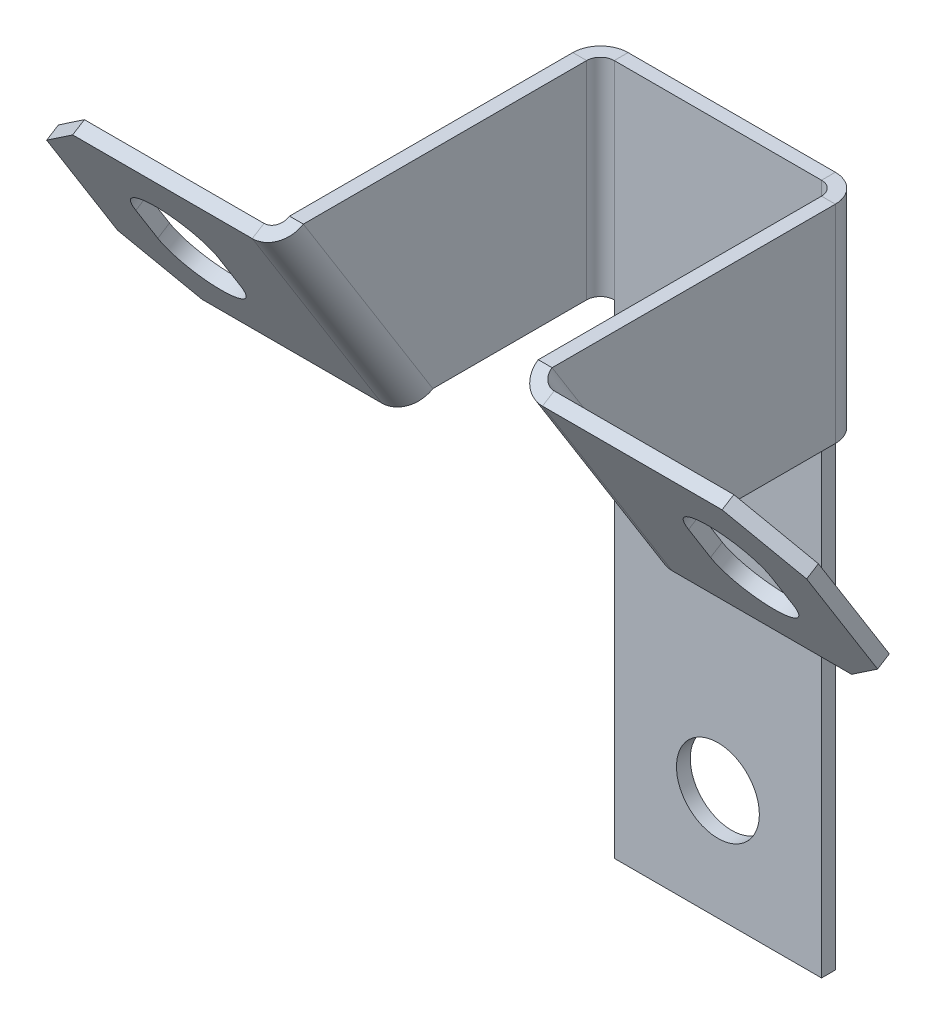
from build123d import *

# Parameters (mm, degrees)
BASE_FLANGE1_START      = -1
BASE_FLANGE1_OUTLINE_W  = 100
BASE_FLANGE1_OUTLINE_H  = 30
BASE_FLANGE1_DEPTH      = 2
EDGE_FLANGE1_DEPTH      = 30
EDGE_FLANGE1_START      = 2
EDGE_FLANGE1_FLAT_DEPTH = 2
SKETCH11_R              = 6
CUT_EXTRUDE2_DEPTH      = 2
EDGE_FLANGE2_DEPTH      = 35.375352101
CUT_EXTRUDE1_DEPTH      = 10
CHAMFER1_SIZE           = 8


# Read off the part's stored shape, not the designer's step: Base-Flange1
# Sheet-metal steps are written as plain solids
with BuildPart() as part:
    # Base-Flange1 outline → Base-Flange1 (new body)
    with BuildSketch(Plane(origin=(0, 0, 0), x_dir=(0, 1, 0), z_dir=(0, 0, 1)).offset(BASE_FLANGE1_START)):
        with Locations((50, 15)):
            Rectangle(BASE_FLANGE1_OUTLINE_W, BASE_FLANGE1_OUTLINE_H)
    extrude(amount=BASE_FLANGE1_DEPTH)

    # Edge-Flange1 bend section (across the edge) → Edge-Flange1 (add)
    with BuildSketch(Plane(origin=(2, 70, 1), x_dir=(-1, 0, 0), z_dir=(0, 1, 0))):
        with BuildLine():
            Line((-2, 2), (0, 2))
            ThreePointArc((0, 2), (0.585786438, 0.585786438), (2, 0))
            Line((2, 0), (2, -2))
            ThreePointArc((2, -2), (-0.828427125, -0.828427125), (-2, 2))
        make_face()
    extrude(amount=EDGE_FLANGE1_DEPTH)

    # Edge-Flange1 profile (on flange) → Edge-Flange1 flat (add)
    with BuildSketch(Plane(origin=(2, 0, 1), x_dir=(0, 1, 0), z_dir=(1, 0, 0)).offset(EDGE_FLANGE1_START)):
        Polygon((70, 2), (100, 2), (100, 43), (70, 24.253919443), align=None)
    extrude(amount=-EDGE_FLANGE1_FLAT_DEPTH)

    # Sketch11 → Cut-Extrude2 (cut)
    with BuildSketch(Plane.XY.offset(1)):
        with Locations((-15, 16)):
            Circle(SKETCH11_R)
    extrude(amount=-CUT_EXTRUDE2_DEPTH, mode=Mode.SUBTRACT)

    # Edge-Flange2 section (across the edge) → Edge-Flange2 (add)
    with BuildSketch(Plane(origin=(4, 98.940161472, 45.696096192), x_dir=(0, 0.5299192642332061, -0.8480480961564253), z_dir=(-1.8389111764499846e-15, -0.8480480961564253, -0.5299192642332061))):
        with BuildLine():
            Line((-2, 2), (-2, 36))
            Line((-2, 36), (0, 36))
            Line((0, 36), (0, 2))
            ThreePointArc((0, 2), (0.585786438, 0.585786438), (2, 0))
            Line((2, 0), (2, -2))
            ThreePointArc((2, -2), (-0.828427125, -0.828427125), (-2, 2))
        make_face()
    extrude(amount=EDGE_FLANGE2_DEPTH)

    # Sketch15 → Cut-Extrude1 (cut)
    with BuildSketch(Plane(origin=(0, 6.188296585, -9.903344701), x_dir=(1, 0, 0), z_dir=(0, -0.5299192642332063, 0.8480480961564252))):
        with BuildLine():
            Line((31, 92.745905141), (31, 86.745905141))
            ThreePointArc((31, 86.745905141), (25, 80.745905141), (19, 86.745905141))
            Line((19, 86.745905141), (19, 92.745905141))
            ThreePointArc((19, 92.745905141), (25, 98.745905141), (31, 92.745905141))
        make_face()
    extrude(amount=-CUT_EXTRUDE1_DEPTH, mode=Mode.SUBTRACT)

    # Chamfer1
    chamfer1_edges = [part.edges().sort_by_distance(p)[0] for p in [
        (40, 98.410242207, 46.544144288),
        (40, 68.410242207, 27.798063731),
    ]]
    chamfer(chamfer1_edges, length=CHAMFER1_SIZE)

    # SurfaceCut1
    split(bisect_by=Plane.YZ.offset(-15), keep=Keep.TOP)

    # Mirror1: part across plane


with BuildPart() as part_1:
    add(part.part)
    add(part.part.mirror(Plane(origin=(-15, 0, 0), x_dir=(0, 0, 1), z_dir=(1, 0, 0))))


solid = part_1.part
